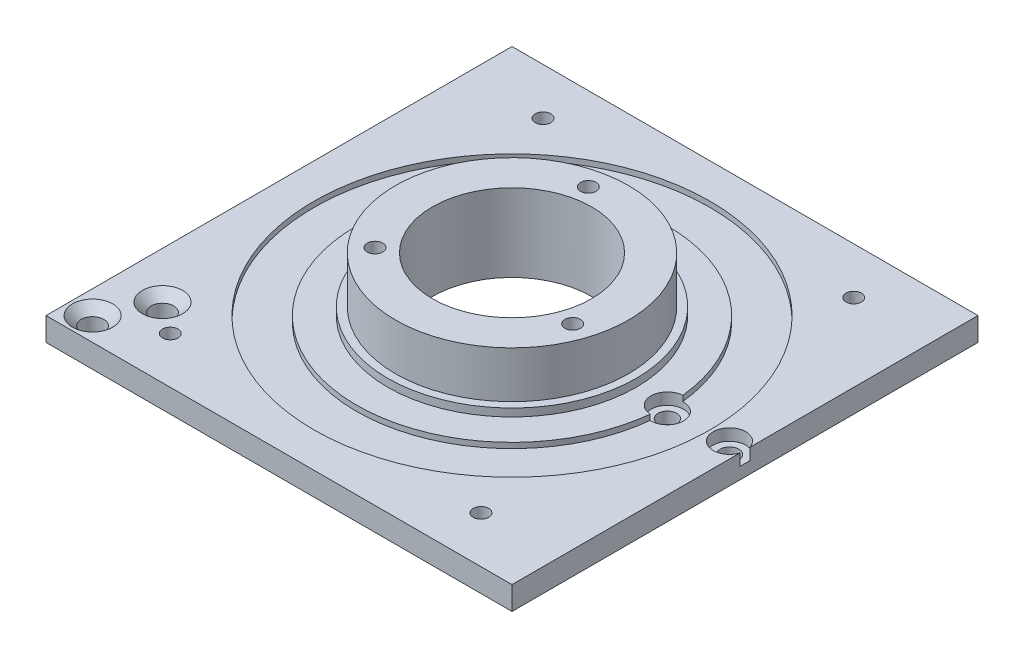
from build123d import *

# Parameters (mm, degrees)
SKETCH1_W                                      = 60
SKETCH1_H                                      = 60
BOSS_EXTRUDE1_DEPTH                            = 3
SKETCH3_R                                      = 1
CUT_EXTRUDE3_DEPTH                             = 43.532340636
SKETCH5_R                                      = 10.25
CUT_EXTRUDE4_DEPTH                             = 43.532340636
SKETCH6_R                                      = 16
SKETCH6_R_2                                    = 10.25
BOSS_EXTRUDE2_DEPTH                            = 1
SKETCH7_R                                      = 15
SKETCH7_R_2                                    = 10.25
BOSS_EXTRUDE3_DEPTH                            = 7
SKETCH10_R                                     = 1.45
STOP_MOUNT_D2P9_THROUGH_DEPTH                  = 3.01
SKETCH11_R                                     = 2.6
STOP_MOUNT_CSK_D5P2_90DEG_DEPTH                = 1.15
STOP_MOUNT_CSK_D5P2_90DEG_DRAFT                = -45
STOP_MOUNT_CSK_D5P2_90DEG_PROFILE_2_DEPTH      = 1.15
STOP_MOUNT_CSK_D5P2_90DEG_PROFILE_2_DRAFT      = -45
SKETCH13_R                                     = 1.45
YTAB_D2P9_DEPTH                                = 3.01
SKETCH14_R                                     = 1.2
GUIDEBLOCK1_D2P4_DEPTH                         = 3.01
SKETCH15_R                                     = 2.1
GUIDEBLOCK1_HEADCOUNTERBORE_D4P2_DEPTH         = 1.5
SKETCH16_R                                     = 25.5
SKETCH16_R_2                                   = 20
ROTATING_RETAINER_HEAD_CLEARANCE_ANNULUS_DEPTH = 0.7
SKETCH17_R                                     = 1
INNER_RETAINER_M2_TAPPED_ENVELOPE_DEPTH        = 4.3
SKETCH18_R                                     = 1.46
YTAB_THROUGH_HOLE_BACKING_RESTORATION_DEPTH    = 3
SKETCH19_R                                     = 1.25
YTAB_BLIND_M2P5_THREAD_ENVELOPES_DEPTH         = 2.6


with BuildPart() as part:
    # Sketch1 → Boss-Extrude1 (new body)
    with BuildSketch(Plane(origin=(0, 0, 0), x_dir=(1, 0, 0), z_dir=(0, 1, 0))):
        Rectangle(SKETCH1_W, SKETCH1_H)
    extrude(amount=BOSS_EXTRUDE1_DEPTH)

    # Sketch3 → Cut-Extrude3 (cut, through all)
    with BuildSketch(Plane(origin=(0, 3, 0), x_dir=(1, 0, 0), z_dir=(0, 1, 0))):
        with Locations((-20, 24)):
            Circle(SKETCH3_R)
        with Locations((20, 24)):
            Circle(SKETCH3_R)
        with Locations((-20, -24)):
            Circle(SKETCH3_R)
        with Locations((20, -24)):
            Circle(SKETCH3_R)
    extrude(amount=-CUT_EXTRUDE3_DEPTH, mode=Mode.SUBTRACT)

    # Sketch5 → Cut-Extrude4 (cut, through all)
    with BuildSketch(Plane.XZ):
        Circle(SKETCH5_R)
    extrude(amount=-CUT_EXTRUDE4_DEPTH, mode=Mode.SUBTRACT)

    # Sketch6 → Boss-Extrude2 (add)
    with BuildSketch(Plane(origin=(0, 3, 0), x_dir=(1, 0, 0), z_dir=(0, 1, 0))):
        Circle(SKETCH6_R)
        Circle(SKETCH6_R_2, mode=Mode.SUBTRACT)
    extrude(amount=BOSS_EXTRUDE2_DEPTH)

    # Sketch7 → Boss-Extrude3 (add)
    with BuildSketch(Plane(origin=(0, 3, 0), x_dir=(1, 0, 0), z_dir=(0, 1, 0))):
        Circle(SKETCH7_R)
        Circle(SKETCH7_R_2, mode=Mode.SUBTRACT)
    extrude(amount=BOSS_EXTRUDE3_DEPTH)

    # Sketch10 → Stop_Mount_D2p9_Through (cut)
    with BuildSketch(Plane(origin=(0, 3, 0), x_dir=(1, 0, 0), z_dir=(0, 1, 0))):
        with Locations((-24, -21)):
            Circle(SKETCH10_R)
        with Locations((-27, -27)):
            Circle(SKETCH10_R)
    extrude(amount=-STOP_MOUNT_D2P9_THROUGH_DEPTH, mode=Mode.SUBTRACT)


with BuildPart() as stop_mount_csk_d5p2_90deg_tool:
    # Sketch11 → Stop_Mount_CSK_D5p2_90deg (with draft: the straight prism first)
    with BuildSketch(Plane(origin=(0, 3, 0), x_dir=(1, 0, 0), z_dir=(0, 1, 0))):
        with Locations((-24, -21)):
            Circle(SKETCH11_R)
    extrude(amount=-STOP_MOUNT_CSK_D5P2_90DEG_DEPTH)
    # Stop_Mount_CSK_D5p2_90deg: the draft: its side faces are tilted about the plane it starts from
    stop_mount_csk_d5p2_90deg_sides = [stop_mount_csk_d5p2_90deg_tool.faces().sort_by_distance(p)[0] for p in [
        (-26.6, 2.425, 21),
    ]]
    draft(stop_mount_csk_d5p2_90deg_sides, Plane(origin=(0, 3, 0), x_dir=(1, 0, 0), z_dir=(0, 1, 0)), STOP_MOUNT_CSK_D5P2_90DEG_DRAFT)


with BuildPart() as part_1:
    add(part.part)

    # Stop_Mount_CSK_D5p2_90deg: cut by stop_mount_csk_d5p2_90deg_tool
    add(stop_mount_csk_d5p2_90deg_tool.part, mode=Mode.SUBTRACT)


with BuildPart() as stop_mount_csk_d5p2_90deg_profile_2_tool:
    # Sketch11 → Stop_Mount_CSK_D5p2_90deg profile 2 (with draft: the straight prism first)
    with BuildSketch(Plane(origin=(0, 3, 0), x_dir=(1, 0, 0), z_dir=(0, 1, 0))):
        with Locations((-27, -27)):
            Circle(SKETCH11_R)
    extrude(amount=-STOP_MOUNT_CSK_D5P2_90DEG_PROFILE_2_DEPTH)
    # Stop_Mount_CSK_D5p2_90deg profile 2: the draft: its side faces are tilted about the plane it starts from
    stop_mount_csk_d5p2_90deg_profile_2_sides = [stop_mount_csk_d5p2_90deg_profile_2_tool.faces().sort_by_distance(p)[0] for p in [
        (-29.6, 2.425, 27),
    ]]
    draft(stop_mount_csk_d5p2_90deg_profile_2_sides, Plane(origin=(0, 3, 0), x_dir=(1, 0, 0), z_dir=(0, 1, 0)), STOP_MOUNT_CSK_D5P2_90DEG_PROFILE_2_DRAFT)


with BuildPart() as part_2:
    add(part_1.part)

    # Stop_Mount_CSK_D5p2_90deg profile 2: cut by stop_mount_csk_d5p2_90deg_profile_2_tool
    add(stop_mount_csk_d5p2_90deg_profile_2_tool.part, mode=Mode.SUBTRACT)

    # Sketch13 → YTab_D2p9 (cut)
    with BuildSketch(Plane.XZ):
        with Locations((27, -23)):
            Circle(SKETCH13_R)
        with Locations((27, -17)):
            Circle(SKETCH13_R)
    extrude(amount=-YTAB_D2P9_DEPTH, mode=Mode.SUBTRACT)

    # Sketch14 → GuideBlock1_D2p4 (cut)
    with BuildSketch(Plane(origin=(0, 3, 0), x_dir=(1, 0, 0), z_dir=(0, 1, 0))):
        with Locations((28, 0)):
            Circle(SKETCH14_R)
        with Locations((20, 0)):
            Circle(SKETCH14_R)
    extrude(amount=-GUIDEBLOCK1_D2P4_DEPTH, mode=Mode.SUBTRACT)

    # Sketch15 → GuideBlock1_HeadCounterbore_D4p2 (cut)
    with BuildSketch(Plane(origin=(0, 3, 0), x_dir=(1, 0, 0), z_dir=(0, 1, 0))):
        with Locations((28, 0)):
            Circle(SKETCH15_R)
        with Locations((20, 0)):
            Circle(SKETCH15_R)
    extrude(amount=-GUIDEBLOCK1_HEADCOUNTERBORE_D4P2_DEPTH, mode=Mode.SUBTRACT)

    # Sketch16 → Rotating_Retainer_Head_Clearance_Annulus (cut)
    with BuildSketch(Plane(origin=(0, 3, 0), x_dir=(1, 0, 0), z_dir=(0, 1, 0))):
        Circle(SKETCH16_R)
        Circle(SKETCH16_R_2, mode=Mode.SUBTRACT)
    extrude(amount=-ROTATING_RETAINER_HEAD_CLEARANCE_ANNULUS_DEPTH, mode=Mode.SUBTRACT)

    # Sketch17 → Inner_Retainer_M2_Tapped_Envelope (cut)
    with BuildSketch(Plane(origin=(0, 10, 0), x_dir=(1, 0, 0), z_dir=(0, 1, 0))):
        with Locations((-9.399263552, -8.240378916)):
            Circle(SKETCH17_R)
        with Locations((-2.436745703, 12.260190471)):
            Circle(SKETCH17_R)
        with Locations((11.836009254, -4.019811554)):
            Circle(SKETCH17_R)
    extrude(amount=-INNER_RETAINER_M2_TAPPED_ENVELOPE_DEPTH, mode=Mode.SUBTRACT)

    # Sketch18 → YTab_Through_Hole_Backing_Restoration (add)
    with BuildSketch(Plane.XZ):
        with Locations((27, -23)):
            Circle(SKETCH18_R)
        with Locations((27, -17)):
            Circle(SKETCH18_R)
    extrude(amount=-YTAB_THROUGH_HOLE_BACKING_RESTORATION_DEPTH)

    # Sketch19 → YTab_Blind_M2p5_Thread_Envelopes (cut)
    with BuildSketch(Plane.XZ):
        with Locations((27, -23)):
            Circle(SKETCH19_R)
        with Locations((27, -17)):
            Circle(SKETCH19_R)
    extrude(amount=-YTAB_BLIND_M2P5_THREAD_ENVELOPES_DEPTH, mode=Mode.SUBTRACT)


solid = part_2.part
